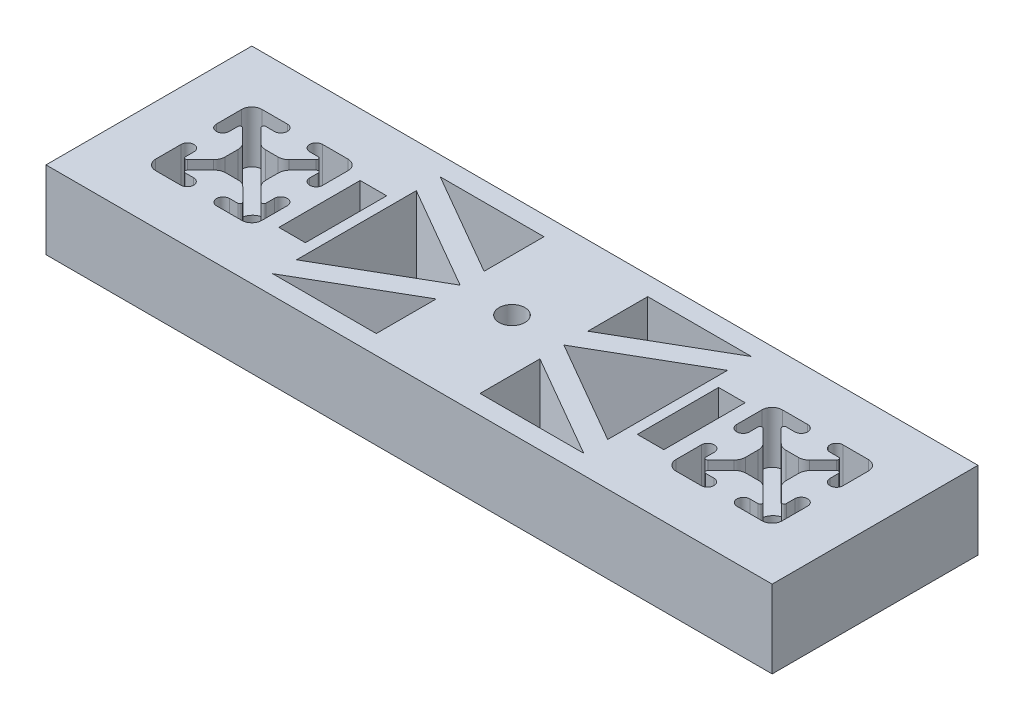
from build123d import *

# Parameters (mm, degrees)
SKETCH1_W               = 177.8
SKETCH1_H               = 50.4000008
BOSS_EXTRUDE1_DEPTH     = 6.35
SKETCH2_W               = 177.8
SKETCH2_H               = 50.4000008
BOSS_EXTRUDE2_DEPTH     = 12.7
SKETCH3_R               = 3.175
CUT_EXTRUDE1_DEPTH      = 10.16
CUT_EXTRUDE2_DEPTH      = 186.784559586
SKETCH5_W               = 6.5
SKETCH5_H               = 19.9
CUT_EXTRUDE3_DEPTH      = 10.2
SKETCH6_W               = 6.5
SKETCH6_H               = 4.572
CUT_EXTRUDE4_DEPTH      = 186.086574555
CUT_EXTRUDE5_DEPTH      = 186.241167349
CUT_EXTRUDE5_DEPTH_BACK = 186.241167349
SKETCH7_R               = 2.921
CUT_EXTRUDE6_DEPTH      = 186.241167349
CUT_EXTRUDE6_DEPTH_BACK = 186.241167349
SKETCH8_R               = 2.921
CHAMFER2_SIZE           = 3.302
CHAMFER3_SIZE           = 3.302


with BuildPart() as part:
    # Sketch1 → Boss-Extrude1 (new body)
    with BuildSketch(Plane(origin=(0, 0, 0), x_dir=(1, 0, 0), z_dir=(0, 1, 0))):
        with Locations((88.9, 25.2000004)):
            Rectangle(SKETCH1_W, SKETCH1_H)
    extrude(amount=BOSS_EXTRUDE1_DEPTH)

    # Sketch2 → Boss-Extrude2 (add)
    with BuildSketch(Plane(origin=(0, 6.35, 0), x_dir=(1, 0, 0), z_dir=(0, 1, 0))):
        with Locations((88.9, 25.2000004)):
            Rectangle(SKETCH2_W, SKETCH2_H)
        with BuildLine():
            Line((38.207602115, 29.52001185), (38.207602115, 35.7371571))
            ThreePointArc((38.207602115, 35.7371571), (37.48390875, 37.484307436), (35.736758415, 38.2080008))
            Line((35.736758415, 38.2080008), (29.519613165, 38.2080008))
            ThreePointArc((29.519613165, 38.2080008), (27.941613165, 36.6300008), (29.519613165, 35.0520008))
            Line((29.519613165, 35.0520008), (31.618952135, 35.0520008))
            ThreePointArc((31.618952135, 35.0520008), (32.082805957, 34.741944038), (31.973665066, 34.194784253))
            Line((31.973665066, 34.194784253), (28.637609194, 30.863479703))
            ThreePointArc((28.637609194, 30.863479703), (27.774459736, 30.287408726), (26.756632806, 30.085138862))
            Line((26.756632806, 30.085138862), (23.642969309, 30.085138862))
            ThreePointArc((23.642969309, 30.085138862), (22.625142379, 30.287408726), (21.761992921, 30.863479703))
            Line((21.761992921, 30.863479703), (18.425937049, 34.194784253))
            ThreePointArc((18.425937049, 34.194784253), (18.316796158, 34.741944038), (18.78064998, 35.0520008))
            Line((18.78064998, 35.0520008), (20.87998895, 35.0520008))
            ThreePointArc((20.87998895, 35.0520008), (22.45798895, 36.6300008), (20.87998895, 38.2080008))
            Line((20.87998895, 38.2080008), (14.6628437, 38.2080008))
            ThreePointArc((14.6628437, 38.2080008), (12.915693364, 37.484307436), (12.192, 35.7371571))
            Line((12.192, 35.7371571), (12.192, 29.52001185))
            ThreePointArc((12.192, 29.52001185), (13.77, 27.94201185), (15.348, 29.52001185))
            Line((15.348, 29.52001185), (15.348, 31.596493464))
            ThreePointArc((15.348, 31.596493464), (15.657726258, 32.060210386), (16.204710632, 31.95171231))
            Line((16.204710632, 31.95171231), (19.406929995, 28.754053655))
            ThreePointArc((19.406929995, 28.754053655), (20.019806023, 27.837880259), (20.235040084, 26.756832148))
            Line((20.235040084, 26.756832148), (20.235040084, 23.643168652))
            ThreePointArc((20.235040084, 23.643168652), (20.019806023, 22.562120541), (19.406929995, 21.645947145))
            Line((19.406929995, 21.645947145), (16.204710632, 18.44828849))
            ThreePointArc((16.204710632, 18.44828849), (15.657726258, 18.339790414), (15.348, 18.803507336))
            Line((15.348, 18.803507336), (15.348, 20.87998895))
            ThreePointArc((15.348, 20.87998895), (13.77, 22.45798895), (12.192, 20.87998895))
            Line((12.192, 20.87998895), (12.192, 14.6628437))
            ThreePointArc((12.192, 14.6628437), (12.915693364, 12.915693364), (14.6628437, 12.192))
            Line((14.6628437, 12.192), (20.812064149, 12.192))
            ThreePointArc((20.812064149, 12.192), (22.390064149, 13.77), (20.812064149, 15.348))
            Line((20.812064149, 15.348), (18.78064998, 15.348))
            ThreePointArc((18.78064998, 15.348), (18.316796158, 15.658056762), (18.425937049, 16.205216547))
            Line((18.425937049, 16.205216547), (21.761992921, 19.536521097))
            ThreePointArc((21.761992921, 19.536521097), (22.625142379, 20.112592074), (23.642969309, 20.314861938))
            Line((23.642969309, 20.314861938), (26.756632806, 20.314861938))
            ThreePointArc((26.756632806, 20.314861938), (27.774459736, 20.112592074), (28.637609194, 19.536521097))
            Line((28.637609194, 19.536521097), (31.973665066, 16.205216547))
            ThreePointArc((31.973665066, 16.205216547), (32.082805957, 15.658056762), (31.618952135, 15.348))
            Line((31.618952135, 15.348), (29.587537966, 15.348))
            ThreePointArc((29.587537966, 15.348), (28.009537966, 13.77), (29.587537966, 12.192))
            Line((29.587537966, 12.192), (35.736758415, 12.192))
            ThreePointArc((35.736758415, 12.192), (37.48390875, 12.915693364), (38.207602115, 14.6628437))
            Line((38.207602115, 14.6628437), (38.207602115, 20.87998895))
            ThreePointArc((38.207602115, 20.87998895), (36.629602115, 22.45798895), (35.051602115, 20.87998895))
            Line((35.051602115, 20.87998895), (35.051602115, 18.803507336))
            ThreePointArc((35.051602115, 18.803507336), (34.741875857, 18.339790414), (34.194891482, 18.44828849))
            Line((34.194891482, 18.44828849), (30.99267212, 21.645947145))
            ThreePointArc((30.99267212, 21.645947145), (30.379796092, 22.562120541), (30.16456203, 23.643168652))
            Line((30.16456203, 23.643168652), (30.16456203, 26.756832148))
            ThreePointArc((30.16456203, 26.756832148), (30.379796092, 27.837880259), (30.99267212, 28.754053655))
            Line((30.99267212, 28.754053655), (34.194891482, 31.95171231))
            ThreePointArc((34.194891482, 31.95171231), (34.741875857, 32.060210386), (35.051602115, 31.596493464))
            Line((35.051602115, 31.596493464), (35.051602115, 29.52001185))
            ThreePointArc((35.051602115, 29.52001185), (36.629602115, 27.94201185), (38.207602115, 29.52001185))
        make_face(mode=Mode.SUBTRACT)
        with BuildLine():
            Line((142.748397885, 31.596493464), (142.748397885, 29.52001185))
            ThreePointArc((142.748397885, 29.52001185), (141.170397885, 27.94201185), (139.592397885, 29.52001185))
            Line((139.592397885, 29.52001185), (139.592397885, 35.7371571))
            ThreePointArc((139.592397885, 35.7371571), (140.31609125, 37.484307436), (142.063241585, 38.2080008))
            Line((142.063241585, 38.2080008), (148.280386835, 38.2080008))
            ThreePointArc((148.280386835, 38.2080008), (149.858386835, 36.6300008), (148.280386835, 35.0520008))
            Line((148.280386835, 35.0520008), (146.181047865, 35.0520008))
            ThreePointArc((146.181047865, 35.0520008), (145.717194043, 34.741944038), (145.826334934, 34.194784253))
            Line((145.826334934, 34.194784253), (149.162390806, 30.863479703))
            ThreePointArc((149.162390806, 30.863479703), (150.025540264, 30.287408726), (151.043367194, 30.085138862))
            Line((151.043367194, 30.085138862), (154.157030691, 30.085138862))
            ThreePointArc((154.157030691, 30.085138862), (155.174857621, 30.287408726), (156.038007079, 30.863479703))
            Line((156.038007079, 30.863479703), (159.374062951, 34.194784253))
            ThreePointArc((159.374062951, 34.194784253), (159.483203842, 34.741944038), (159.01935002, 35.0520008))
            Line((159.01935002, 35.0520008), (156.92001105, 35.0520008))
            ThreePointArc((156.92001105, 35.0520008), (155.34201105, 36.6300008), (156.92001105, 38.2080008))
            Line((156.92001105, 38.2080008), (163.1371563, 38.2080008))
            ThreePointArc((163.1371563, 38.2080008), (164.884306636, 37.484307436), (165.608, 35.7371571))
            Line((165.608, 35.7371571), (165.608, 29.52001185))
            ThreePointArc((165.608, 29.52001185), (164.03, 27.94201185), (162.452, 29.52001185))
            Line((162.452, 29.52001185), (162.452, 31.596493464))
            ThreePointArc((162.452, 31.596493464), (162.142273742, 32.060210386), (161.595289368, 31.95171231))
            Line((161.595289368, 31.95171231), (158.393070005, 28.754053655))
            ThreePointArc((158.393070005, 28.754053655), (157.780193977, 27.837880259), (157.564959916, 26.756832148))
            Line((157.564959916, 26.756832148), (157.564959916, 23.643168652))
            ThreePointArc((157.564959916, 23.643168652), (157.780193977, 22.562120541), (158.393070005, 21.645947145))
            Line((158.393070005, 21.645947145), (161.595289368, 18.44828849))
            ThreePointArc((161.595289368, 18.44828849), (162.142273742, 18.339790414), (162.452, 18.803507336))
            Line((162.452, 18.803507336), (162.452, 20.87998895))
            ThreePointArc((162.452, 20.87998895), (164.03, 22.45798895), (165.608, 20.87998895))
            Line((165.608, 20.87998895), (165.608, 14.6628437))
            ThreePointArc((165.608, 14.6628437), (164.884306636, 12.915693364), (163.1371563, 12.192))
            Line((163.1371563, 12.192), (156.987935851, 12.192))
            ThreePointArc((156.987935851, 12.192), (155.409935851, 13.77), (156.987935851, 15.348))
            Line((156.987935851, 15.348), (159.01935002, 15.348))
            ThreePointArc((159.01935002, 15.348), (159.483203842, 15.658056762), (159.374062951, 16.205216547))
            Line((159.374062951, 16.205216547), (156.038007079, 19.536521097))
            ThreePointArc((156.038007079, 19.536521097), (155.174857621, 20.112592074), (154.157030691, 20.314861938))
            Line((154.157030691, 20.314861938), (151.043367194, 20.314861938))
            ThreePointArc((151.043367194, 20.314861938), (150.025540264, 20.112592074), (149.162390806, 19.536521097))
            Line((149.162390806, 19.536521097), (145.826334934, 16.205216547))
            ThreePointArc((145.826334934, 16.205216547), (145.717194043, 15.658056762), (146.181047865, 15.348))
            Line((146.181047865, 15.348), (148.212462034, 15.348))
            ThreePointArc((148.212462034, 15.348), (149.790462034, 13.77), (148.212462034, 12.192))
            Line((148.212462034, 12.192), (142.063241585, 12.192))
            ThreePointArc((142.063241585, 12.192), (140.31609125, 12.915693364), (139.592397885, 14.6628437))
            Line((139.592397885, 14.6628437), (139.592397885, 20.87998895))
            ThreePointArc((139.592397885, 20.87998895), (141.170397885, 22.45798895), (142.748397885, 20.87998895))
            Line((142.748397885, 20.87998895), (142.748397885, 18.803507336))
            ThreePointArc((142.748397885, 18.803507336), (143.058124143, 18.339790414), (143.605108518, 18.44828849))
            Line((143.605108518, 18.44828849), (146.80732788, 21.645947145))
            ThreePointArc((146.80732788, 21.645947145), (147.420203908, 22.562120541), (147.63543797, 23.643168652))
            Line((147.63543797, 23.643168652), (147.63543797, 26.756832148))
            ThreePointArc((147.63543797, 26.756832148), (147.420203908, 27.837880259), (146.80732788, 28.754053655))
            Line((146.80732788, 28.754053655), (143.605108518, 31.95171231))
            ThreePointArc((143.605108518, 31.95171231), (143.058124143, 32.060210386), (142.748397885, 31.596493464))
        make_face(mode=Mode.SUBTRACT)
    extrude(amount=BOSS_EXTRUDE2_DEPTH)

    # Sketch3 → Cut-Extrude1 (cut)
    with BuildSketch(Plane(origin=(0, 19.05, 0), x_dir=(1, 0, 0), z_dir=(0, 1, 0))):
        with Locations((88.9, 25.2000004)):
            Circle(SKETCH3_R)
    extrude(amount=-CUT_EXTRUDE1_DEPTH, mode=Mode.SUBTRACT)

    # Sketch4 → Cut-Extrude2 (cut, through all)
    with BuildSketch(Plane(origin=(0, 19.05, 0), x_dir=(1, 0, 0), z_dir=(0, 1, 0))):
        Polygon((50.8, 45.730575972), (76.2, 45.730575972), (76.2, 31.065879135), align=None)
        Polygon((76.2, 19.334121665), (76.2, 4.669424828), (50.8, 4.669424828), align=None)
        Polygon((50.8, 39.864697237), (50.8, 10.535303563), (76.2, 25.2000004), align=None)
        Polygon((101.6, 25.2000004), (127, 39.864697237), (127, 10.535303563), align=None)
        Polygon((127, 4.669424828), (101.6, 19.334121665), (101.6, 4.669424828), align=None)
        Polygon((101.6, 31.065879135), (127, 45.730575972), (101.6, 45.730575972), align=None)
    extrude(amount=-CUT_EXTRUDE2_DEPTH, mode=Mode.SUBTRACT)

    # Sketch5 → Cut-Extrude3 (cut)
    with BuildSketch(Plane(origin=(0, 19.05, 0), x_dir=(1, 0, 0), z_dir=(0, 1, 0))):
        with Locations((45.013602115, 25.2000004)):
            Rectangle(SKETCH5_W, SKETCH5_H)
    cut_extrude3 = extrude(amount=-CUT_EXTRUDE3_DEPTH, mode=Mode.SUBTRACT)

    # Sketch6 → Cut-Extrude4 (cut, through all)
    with BuildSketch(Plane(origin=(0, 8.85, 0), x_dir=(1, 0, 0), z_dir=(0, 1, 0))):
        with Locations((45.013602115, 32.8640004)):
            Rectangle(SKETCH6_W, SKETCH6_H)
        with Locations((45.013602115, 25.2000004)):
            Rectangle(SKETCH6_W, SKETCH6_H)
        with Locations((45.013602115, 17.5360004)):
            Rectangle(SKETCH6_W, SKETCH6_H)
    cut_extrude4 = extrude(amount=-CUT_EXTRUDE4_DEPTH, mode=Mode.SUBTRACT)

    # Mirror1: Cut-Extrude3, Cut-Extrude4 across plane
    add(cut_extrude3.mirror(Plane.ZY.offset(-88.9)), mode=Mode.SUBTRACT)
    add(cut_extrude4.mirror(Plane.ZY.offset(-88.9)), mode=Mode.SUBTRACT)

    # Sketch7 → Cut-Extrude5 (cut, two sides: drawn at the far end of the back side and taken through both)
    with BuildSketch(Plane(origin=(0, 6.35, 0), x_dir=(1, 0, 0), z_dir=(0, 1, 0)).offset(-CUT_EXTRUDE5_DEPTH_BACK)):
        with Locations((25.33856203, 25.259138862)):
            Circle(SKETCH7_R)
    extrude(amount=CUT_EXTRUDE5_DEPTH + CUT_EXTRUDE5_DEPTH_BACK, mode=Mode.SUBTRACT)

    # Sketch8 → Cut-Extrude6 (cut, two sides: drawn at the far end of the back side and taken through both)
    with BuildSketch(Plane(origin=(0, 6.35, 0), x_dir=(1, 0, 0), z_dir=(0, 1, 0)).offset(-CUT_EXTRUDE6_DEPTH_BACK)):
        with Locations((152.738959916, 25.259138862)):
            Circle(SKETCH8_R)
    extrude(amount=CUT_EXTRUDE6_DEPTH + CUT_EXTRUDE6_DEPTH_BACK, mode=Mode.SUBTRACT)

    # Chamfer2
    chamfer2_edges = [part.edges().sort_by_distance(p)[0] for p in [
        (149.817959916, 0, -25.259138862),
    ]]
    chamfer(chamfer2_edges, length=CHAMFER2_SIZE)

    # Chamfer3
    chamfer3_edges = [part.edges().sort_by_distance(p)[0] for p in [
        (22.41756203, 0, -25.259138862),
    ]]
    chamfer(chamfer3_edges, length=CHAMFER3_SIZE)


solid = part.part
